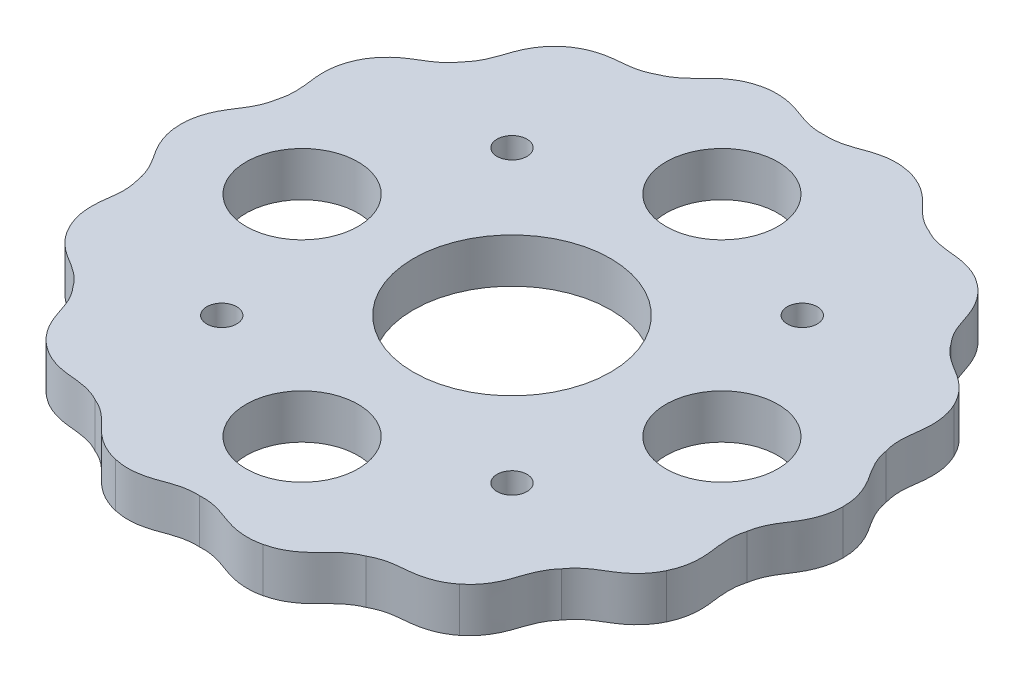
from build123d import *

# Parameters (mm, degrees)
BOSS_EXTRUDE3_DEPTH = 4.7625
SKETCH2_R           = 10.5635
SKETCH2_R_2         = 6
CUT_EXTRUDE1_DEPTH  = 4.7625
SKETCH2_4_R         = 1.607
CUT_EXTRUDE2_DEPTH  = 2.4105


with BuildPart() as part:
    # Sketch1 → Boss-Extrude3 (new body)
    with BuildSketch(Plane(origin=(0, 0, 0), x_dir=(1, 0, 0), z_dir=(0, 1, 0))):
        with BuildLine():
            Line((35.500002326, 0.003735881), (35.500002326, 0))
            Line((35.500002326, 0), (35.500002326, -0.003735881))
            add(Edge.make_bspline(
                [(32.644810899, -7.45096506), (32.674793712, -7.260710929), (32.757965618, -6.873262555), (32.975088878, -6.197475635), (33.30681421, -5.487322542), (33.693887271, -4.83935734), (34.139372051, -4.165162167), (34.499748971, -3.6014921), (34.870711868, -2.889611748), (35.149566879, -2.192738575), (35.418263863, -1.23361479), (35.50061524, -0.495919336), (35.500002326, -0.003735881)],
                knots=[0.02301065, 0.02301065, 0.02301065, 0.02301065, 0.053541567, 0.084072485, 0.145134319, 0.206196153, 0.267257988, 0.389381656, 0.511505325, 0.633628994, 0.755752663, 1, 1, 1, 1], degree=3))
            add(Edge.make_bspline(
                [(31.986017844, -15.399507835), (32.200120458, -14.956331799), (32.445998494, -14.255960238), (32.62005909, -13.275236314), (32.671181344, -12.526384626), (32.645828632, -11.724047822), (32.565707523, -11.059836954), (32.456861927, -10.25911949), (32.389262714, -9.507378309), (32.398512397, -8.723622254), (32.496104055, -8.020553026), (32.589276306, -7.635387164), (32.644810899, -7.45096506)],
                knots=[0.02301065, 0.02301065, 0.02301065, 0.02301065, 0.267257988, 0.389381656, 0.511505325, 0.633628994, 0.755752663, 0.816814497, 0.877876331, 0.938938166, 0.969469083, 1, 1, 1, 1], degree=3))
            Line((31.986017844, -15.399507835), (31.984396906, -15.402873748))
            Line((31.984396906, -15.402873748), (31.982775968, -15.406239661))
            add(Edge.make_bspline(
                [(26.179105738, -20.877140171), (26.288667493, -20.718736177), (26.531710341, -20.405744191), (27.020544594, -19.891087467), (27.62754267, -19.395191866), (28.257425012, -18.979340099), (28.951315253, -18.565199839), (29.520570914, -18.213712342), (30.163670245, -17.733285076), (30.717271866, -17.226414698), (31.375507699, -16.478857279), (31.769777787, -15.849947564), (31.982775968, -15.406239661)],
                knots=[0.02301065, 0.02301065, 0.02301065, 0.02301065, 0.053541567, 0.084072485, 0.145134319, 0.206196153, 0.267257988, 0.389381656, 0.511505325, 0.633628994, 0.755752663, 1, 1, 1, 1], degree=3))
            add(Edge.make_bspline(
                [(22.136810246, -27.752690162), (22.521996911, -27.446297993), (23.047405198, -26.921967502), (23.62974854, -26.113887841), (24.00072267, -25.461376898), (24.326001557, -24.727496287), (24.542005228, -24.094299727), (24.791357022, -23.325651886), (25.05662051, -22.619026286), (25.405013194, -21.916899767), (25.797990545, -21.325799714), (26.049053047, -21.019203188), (26.179105738, -20.877140171)],
                knots=[0.02301065, 0.02301065, 0.02301065, 0.02301065, 0.267257988, 0.389381656, 0.511505325, 0.633628994, 0.755752663, 0.816814497, 0.877876331, 0.938938166, 0.969469083, 1, 1, 1, 1], degree=3))
            Line((22.136810246, -27.752690162), (22.133889416, -27.755019446))
            Line((22.133889416, -27.755019446), (22.130968587, -27.75734873))
            add(Edge.make_bspline(
                [(14.52830762, -30.168341629), (14.695748267, -30.073161626), (15.05052444, -29.89661793), (15.714250068, -29.645025478), (16.476297475, -29.461605575), (17.224233175, -29.360231784), (18.029095404, -29.288171996), (18.694481743, -29.218483478), (19.482343797, -29.064663811), (20.201044438, -28.848188121), (21.118447439, -28.460259983), (21.746546212, -28.06469929), (22.130968587, -27.75734873)],
                knots=[0.02301065, 0.02301065, 0.02301065, 0.02301065, 0.053541567, 0.084072485, 0.145134319, 0.206196153, 0.267257988, 0.389381656, 0.511505325, 0.633628994, 0.755752663, 1, 1, 1, 1], degree=3))
            add(Edge.make_bspline(
                [(7.903135888, -34.609111839), (8.383115662, -34.500188263), (9.083990645, -34.255748926), (9.959276491, -33.780363616), (10.576626521, -33.353431213), (11.188111536, -32.833360849), (11.657457809, -32.356590942), (12.215619812, -31.772252855), (12.761207314, -31.250698702), (13.379739556, -30.769266488), (13.990268616, -30.407210225), (14.349495361, -30.239908237), (14.52830762, -30.168341629)],
                knots=[0.02301065, 0.02301065, 0.02301065, 0.02301065, 0.267257988, 0.389381656, 0.511505325, 0.633628994, 0.755752663, 0.816814497, 0.877876331, 0.938938166, 0.969469083, 1, 1, 1, 1], degree=3))
            Line((7.903135888, -34.609111839), (7.899493673, -34.60994315))
            Line((7.899493673, -34.60994315), (7.895851458, -34.610774462))
            add(Edge.make_bspline(
                [(0, -33.484333037), (0.192155866, -33.471228592), (0.588397592, -33.466099831), (1.295555593, -33.527402621), (2.061719496, -33.692786976), (2.779570716, -33.925969485), (3.535992098, -34.210262493), (4.165721189, -34.43617562), (4.942300224, -34.639429423), (5.683752409, -34.756224087), (6.678619663, -34.804759157), (7.416144457, -34.72089313), (7.895851458, -34.610774462)],
                knots=[0.02301065, 0.02301065, 0.02301065, 0.02301065, 0.053541567, 0.084072485, 0.145134319, 0.206196153, 0.267257988, 0.389381656, 0.511505325, 0.633628994, 0.755752663, 1, 1, 1, 1], degree=3))
            add(Edge.make_bspline(
                [(-7.895851458, -34.610774462), (-7.416144457, -34.72089313), (-6.678619663, -34.804759157), (-5.683752409, -34.756224087), (-4.942300224, -34.639429423), (-4.165721189, -34.43617562), (-3.535992098, -34.210262493), (-2.779570716, -33.925969485), (-2.061719496, -33.692786976), (-1.295555593, -33.527402621), (-0.588397592, -33.466099831), (-0.192155866, -33.471228592), (0, -33.484333037)],
                knots=[0.02301065, 0.02301065, 0.02301065, 0.02301065, 0.267257988, 0.389381656, 0.511505325, 0.633628994, 0.755752663, 0.816814497, 0.877876331, 0.938938166, 0.969469083, 1, 1, 1, 1], degree=3))
            Line((-7.895851458, -34.610774462), (-7.899493673, -34.60994315))
            Line((-7.899493673, -34.60994315), (-7.903135888, -34.609111839))
            add(Edge.make_bspline(
                [(-14.52830762, -30.168341629), (-14.349495361, -30.239908237), (-13.990268616, -30.407210225), (-13.379739556, -30.769266488), (-12.761207314, -31.250698702), (-12.215619812, -31.772252855), (-11.657457809, -32.356590942), (-11.188111536, -32.833360849), (-10.576626521, -33.353431213), (-9.959276491, -33.780363616), (-9.083990645, -34.255748926), (-8.383115662, -34.500188263), (-7.903135888, -34.609111839)],
                knots=[0.02301065, 0.02301065, 0.02301065, 0.02301065, 0.053541567, 0.084072485, 0.145134319, 0.206196153, 0.267257988, 0.389381656, 0.511505325, 0.633628994, 0.755752663, 1, 1, 1, 1], degree=3))
            add(Edge.make_bspline(
                [(-22.130968587, -27.75734873), (-21.746546212, -28.06469929), (-21.118447439, -28.460259983), (-20.201044438, -28.848188121), (-19.482343797, -29.064663811), (-18.694481743, -29.218483478), (-18.029095404, -29.288171996), (-17.224233175, -29.360231784), (-16.476297475, -29.461605575), (-15.714250068, -29.645025478), (-15.05052444, -29.89661793), (-14.695748267, -30.073161626), (-14.52830762, -30.168341629)],
                knots=[0.02301065, 0.02301065, 0.02301065, 0.02301065, 0.267257988, 0.389381656, 0.511505325, 0.633628994, 0.755752663, 0.816814497, 0.877876331, 0.938938166, 0.969469083, 1, 1, 1, 1], degree=3))
            Line((-22.130968587, -27.75734873), (-22.133889416, -27.755019446))
            Line((-22.133889416, -27.755019446), (-22.136810246, -27.752690162))
            add(Edge.make_bspline(
                [(-26.179105738, -20.877140171), (-26.049053047, -21.019203188), (-25.797990545, -21.325799714), (-25.405013194, -21.916899767), (-25.05662051, -22.619026286), (-24.791357022, -23.325651886), (-24.542005228, -24.094299727), (-24.326001557, -24.727496287), (-24.00072267, -25.461376898), (-23.62974854, -26.113887841), (-23.047405198, -26.921967502), (-22.521996911, -27.446297993), (-22.136810246, -27.752690162)],
                knots=[0.02301065, 0.02301065, 0.02301065, 0.02301065, 0.053541567, 0.084072485, 0.145134319, 0.206196153, 0.267257988, 0.389381656, 0.511505325, 0.633628994, 0.755752663, 1, 1, 1, 1], degree=3))
            add(Edge.make_bspline(
                [(-31.982775968, -15.406239661), (-31.769777787, -15.849947564), (-31.375507698, -16.478857279), (-30.717271866, -17.226414698), (-30.163670245, -17.733285076), (-29.520570914, -18.213712342), (-28.951315253, -18.565199839), (-28.257425012, -18.979340099), (-27.62754267, -19.395191866), (-27.020544594, -19.891087467), (-26.531710341, -20.405744191), (-26.288667493, -20.718736177), (-26.179105738, -20.877140171)],
                knots=[0.02301065, 0.02301065, 0.02301065, 0.02301065, 0.267257988, 0.389381656, 0.511505325, 0.633628994, 0.755752663, 0.816814497, 0.877876331, 0.938938166, 0.969469083, 1, 1, 1, 1], degree=3))
            Line((-31.982775968, -15.406239661), (-31.984396906, -15.402873748))
            Line((-31.984396906, -15.402873748), (-31.986017844, -15.399507835))
            add(Edge.make_bspline(
                [(-32.644810899, -7.45096506), (-32.589276306, -7.635387164), (-32.496104055, -8.020553026), (-32.398512397, -8.723622254), (-32.389262714, -9.507378309), (-32.456861927, -10.25911949), (-32.565707523, -11.059836954), (-32.645828632, -11.724047822), (-32.671181344, -12.526384626), (-32.62005909, -13.275236314), (-32.445998494, -14.255960238), (-32.200120458, -14.956331799), (-31.986017844, -15.399507835)],
                knots=[0.02301065, 0.02301065, 0.02301065, 0.02301065, 0.053541567, 0.084072485, 0.145134319, 0.206196153, 0.267257988, 0.389381656, 0.511505325, 0.633628994, 0.755752663, 1, 1, 1, 1], degree=3))
            add(Edge.make_bspline(
                [(-35.500002326, -0.003735881), (-35.50061524, -0.495919336), (-35.418263863, -1.23361479), (-35.149566879, -2.192738575), (-34.870711868, -2.889611748), (-34.499748971, -3.6014921), (-34.139372051, -4.165162167), (-33.693887271, -4.83935734), (-33.30681421, -5.487322542), (-32.975088878, -6.197475635), (-32.757965618, -6.873262555), (-32.674793712, -7.260710929), (-32.644810899, -7.45096506)],
                knots=[0.02301065, 0.02301065, 0.02301065, 0.02301065, 0.267257988, 0.389381656, 0.511505325, 0.633628994, 0.755752663, 0.816814497, 0.877876331, 0.938938166, 0.969469083, 1, 1, 1, 1], degree=3))
            Line((-35.500002326, -0.003735881), (-35.500002326, 0))
            Line((-35.500002326, 0), (-35.500002326, 0.003735881))
            add(Edge.make_bspline(
                [(-32.644810899, 7.45096506), (-32.674793712, 7.260710929), (-32.757965618, 6.873262555), (-32.975088878, 6.197475635), (-33.30681421, 5.487322542), (-33.693887271, 4.83935734), (-34.139372051, 4.165162167), (-34.499748971, 3.6014921), (-34.870711868, 2.889611748), (-35.149566879, 2.192738575), (-35.418263863, 1.23361479), (-35.50061524, 0.495919336), (-35.500002326, 0.003735881)],
                knots=[0.02301065, 0.02301065, 0.02301065, 0.02301065, 0.053541567, 0.084072485, 0.145134319, 0.206196153, 0.267257988, 0.389381656, 0.511505325, 0.633628994, 0.755752663, 1, 1, 1, 1], degree=3))
            add(Edge.make_bspline(
                [(-31.986017844, 15.399507835), (-32.200120458, 14.956331799), (-32.445998494, 14.255960238), (-32.62005909, 13.275236314), (-32.671181344, 12.526384626), (-32.645828632, 11.724047822), (-32.565707523, 11.059836954), (-32.456861927, 10.25911949), (-32.389262714, 9.507378309), (-32.398512397, 8.723622254), (-32.496104055, 8.020553026), (-32.589276306, 7.635387164), (-32.644810899, 7.45096506)],
                knots=[0.02301065, 0.02301065, 0.02301065, 0.02301065, 0.267257988, 0.389381656, 0.511505325, 0.633628994, 0.755752663, 0.816814497, 0.877876331, 0.938938166, 0.969469083, 1, 1, 1, 1], degree=3))
            Line((-31.986017844, 15.399507835), (-31.984396906, 15.402873748))
            Line((-31.984396906, 15.402873748), (-31.982775968, 15.406239661))
            add(Edge.make_bspline(
                [(-26.179105738, 20.877140171), (-26.288667493, 20.718736177), (-26.531710341, 20.405744191), (-27.020544594, 19.891087467), (-27.62754267, 19.395191866), (-28.257425012, 18.979340099), (-28.951315253, 18.565199839), (-29.520570914, 18.213712342), (-30.163670245, 17.733285076), (-30.717271866, 17.226414698), (-31.375507699, 16.478857278), (-31.769777787, 15.849947564), (-31.982775968, 15.406239661)],
                knots=[0.02301065, 0.02301065, 0.02301065, 0.02301065, 0.053541567, 0.084072485, 0.145134319, 0.206196153, 0.267257988, 0.389381656, 0.511505325, 0.633628994, 0.755752663, 1, 1, 1, 1], degree=3))
            add(Edge.make_bspline(
                [(-22.136810246, 27.752690162), (-22.521996911, 27.446297993), (-23.047405198, 26.921967502), (-23.62974854, 26.113887841), (-24.00072267, 25.461376898), (-24.326001557, 24.727496287), (-24.542005228, 24.094299727), (-24.791357022, 23.325651886), (-25.05662051, 22.619026286), (-25.405013194, 21.916899767), (-25.797990545, 21.325799714), (-26.049053047, 21.019203188), (-26.179105738, 20.877140171)],
                knots=[0.02301065, 0.02301065, 0.02301065, 0.02301065, 0.267257988, 0.389381656, 0.511505325, 0.633628994, 0.755752663, 0.816814497, 0.877876331, 0.938938166, 0.969469083, 1, 1, 1, 1], degree=3))
            Line((-22.136810246, 27.752690162), (-22.133889416, 27.755019446))
            Line((-22.133889416, 27.755019446), (-22.130968587, 27.75734873))
            add(Edge.make_bspline(
                [(-14.52830762, 30.168341629), (-14.695748267, 30.073161626), (-15.05052444, 29.89661793), (-15.714250068, 29.645025478), (-16.476297475, 29.461605575), (-17.224233175, 29.360231784), (-18.029095404, 29.288171996), (-18.694481743, 29.218483478), (-19.482343797, 29.064663811), (-20.201044438, 28.848188121), (-21.118447439, 28.460259983), (-21.746546212, 28.06469929), (-22.130968587, 27.75734873)],
                knots=[0.02301065, 0.02301065, 0.02301065, 0.02301065, 0.053541567, 0.084072485, 0.145134319, 0.206196153, 0.267257988, 0.389381656, 0.511505325, 0.633628994, 0.755752663, 1, 1, 1, 1], degree=3))
            add(Edge.make_bspline(
                [(-7.903135888, 34.609111839), (-8.383115662, 34.500188263), (-9.083990645, 34.255748926), (-9.959276491, 33.780363616), (-10.576626521, 33.353431213), (-11.188111536, 32.833360849), (-11.657457809, 32.356590942), (-12.215619812, 31.772252855), (-12.761207314, 31.250698702), (-13.379739556, 30.769266488), (-13.990268616, 30.407210225), (-14.349495361, 30.239908237), (-14.52830762, 30.168341629)],
                knots=[0.02301065, 0.02301065, 0.02301065, 0.02301065, 0.267257988, 0.389381656, 0.511505325, 0.633628994, 0.755752663, 0.816814497, 0.877876331, 0.938938166, 0.969469083, 1, 1, 1, 1], degree=3))
            Line((-7.903135888, 34.609111839), (-7.899493673, 34.60994315))
            Line((-7.899493673, 34.60994315), (-7.895851458, 34.610774462))
            add(Edge.make_bspline(
                [(0, 33.484333037), (-0.192155866, 33.471228592), (-0.588397592, 33.466099831), (-1.295555593, 33.527402621), (-2.061719496, 33.692786976), (-2.779570716, 33.925969485), (-3.535992098, 34.210262493), (-4.165721189, 34.43617562), (-4.942300224, 34.639429423), (-5.683752409, 34.756224087), (-6.678619663, 34.804759157), (-7.416144457, 34.72089313), (-7.895851458, 34.610774462)],
                knots=[0.02301065, 0.02301065, 0.02301065, 0.02301065, 0.053541567, 0.084072485, 0.145134319, 0.206196153, 0.267257988, 0.389381656, 0.511505325, 0.633628994, 0.755752663, 1, 1, 1, 1], degree=3))
            add(Edge.make_bspline(
                [(7.895851458, 34.610774462), (7.416144457, 34.72089313), (6.678619663, 34.804759157), (5.683752409, 34.756224087), (4.942300224, 34.639429423), (4.165721189, 34.43617562), (3.535992098, 34.210262493), (2.779570716, 33.925969485), (2.061719496, 33.692786976), (1.295555593, 33.527402621), (0.588397592, 33.466099831), (0.192155866, 33.471228592), (0, 33.484333037)],
                knots=[0.02301065, 0.02301065, 0.02301065, 0.02301065, 0.267257988, 0.389381656, 0.511505325, 0.633628994, 0.755752663, 0.816814497, 0.877876331, 0.938938166, 0.969469083, 1, 1, 1, 1], degree=3))
            Line((7.895851458, 34.610774462), (7.899493673, 34.60994315))
            Line((7.899493673, 34.60994315), (7.903135888, 34.609111839))
            add(Edge.make_bspline(
                [(14.52830762, 30.168341629), (14.349495361, 30.239908237), (13.990268616, 30.407210225), (13.379739556, 30.769266488), (12.761207314, 31.250698702), (12.215619812, 31.772252855), (11.657457809, 32.356590942), (11.188111536, 32.833360849), (10.576626521, 33.353431213), (9.959276491, 33.780363616), (9.083990645, 34.255748926), (8.383115662, 34.500188263), (7.903135888, 34.609111839)],
                knots=[0.02301065, 0.02301065, 0.02301065, 0.02301065, 0.053541567, 0.084072485, 0.145134319, 0.206196153, 0.267257988, 0.389381656, 0.511505325, 0.633628994, 0.755752663, 1, 1, 1, 1], degree=3))
            add(Edge.make_bspline(
                [(22.130968587, 27.75734873), (21.746546212, 28.06469929), (21.118447439, 28.460259983), (20.201044438, 28.848188121), (19.482343797, 29.064663811), (18.694481743, 29.218483478), (18.029095404, 29.288171996), (17.224233175, 29.360231784), (16.476297475, 29.461605575), (15.714250068, 29.645025478), (15.05052444, 29.89661793), (14.695748267, 30.073161626), (14.52830762, 30.168341629)],
                knots=[0.02301065, 0.02301065, 0.02301065, 0.02301065, 0.267257988, 0.389381656, 0.511505325, 0.633628994, 0.755752663, 0.816814497, 0.877876331, 0.938938166, 0.969469083, 1, 1, 1, 1], degree=3))
            Line((22.130968587, 27.75734873), (22.133889416, 27.755019446))
            Line((22.133889416, 27.755019446), (22.136810246, 27.752690162))
            add(Edge.make_bspline(
                [(26.179105738, 20.877140171), (26.049053047, 21.019203188), (25.797990545, 21.325799714), (25.405013194, 21.916899767), (25.05662051, 22.619026286), (24.791357022, 23.325651886), (24.542005228, 24.094299727), (24.326001557, 24.727496287), (24.00072267, 25.461376898), (23.62974854, 26.113887841), (23.047405198, 26.921967502), (22.521996911, 27.446297993), (22.136810246, 27.752690162)],
                knots=[0.02301065, 0.02301065, 0.02301065, 0.02301065, 0.053541567, 0.084072485, 0.145134319, 0.206196153, 0.267257988, 0.389381656, 0.511505325, 0.633628994, 0.755752663, 1, 1, 1, 1], degree=3))
            add(Edge.make_bspline(
                [(31.982775968, 15.406239661), (31.769777787, 15.849947564), (31.375507698, 16.478857279), (30.717271866, 17.226414698), (30.163670245, 17.733285076), (29.520570914, 18.213712342), (28.951315253, 18.565199839), (28.257425012, 18.979340099), (27.62754267, 19.395191866), (27.020544594, 19.891087467), (26.531710341, 20.405744191), (26.288667493, 20.718736177), (26.179105738, 20.877140171)],
                knots=[0.02301065, 0.02301065, 0.02301065, 0.02301065, 0.267257988, 0.389381656, 0.511505325, 0.633628994, 0.755752663, 0.816814497, 0.877876331, 0.938938166, 0.969469083, 1, 1, 1, 1], degree=3))
            Line((31.982775968, 15.406239661), (31.984396906, 15.402873748))
            Line((31.984396906, 15.402873748), (31.986017844, 15.399507835))
            add(Edge.make_bspline(
                [(32.644810899, 7.45096506), (32.589276306, 7.635387164), (32.496104055, 8.020553026), (32.398512397, 8.723622254), (32.389262714, 9.507378309), (32.456861927, 10.25911949), (32.565707523, 11.059836954), (32.645828632, 11.724047822), (32.671181344, 12.526384626), (32.62005909, 13.275236314), (32.445998494, 14.255960238), (32.200120458, 14.956331799), (31.986017844, 15.399507835)],
                knots=[0.02301065, 0.02301065, 0.02301065, 0.02301065, 0.053541567, 0.084072485, 0.145134319, 0.206196153, 0.267257988, 0.389381656, 0.511505325, 0.633628994, 0.755752663, 1, 1, 1, 1], degree=3))
            add(Edge.make_bspline(
                [(35.500002326, 0.003735881), (35.50061524, 0.495919336), (35.418263863, 1.23361479), (35.149566879, 2.192738575), (34.870711868, 2.889611748), (34.499748971, 3.6014921), (34.139372051, 4.165162167), (33.693887271, 4.83935734), (33.30681421, 5.487322542), (32.975088878, 6.197475635), (32.757965618, 6.873262555), (32.674793712, 7.260710929), (32.644810899, 7.45096506)],
                knots=[0.02301065, 0.02301065, 0.02301065, 0.02301065, 0.267257988, 0.389381656, 0.511505325, 0.633628994, 0.755752663, 0.816814497, 0.877876331, 0.938938166, 0.969469083, 1, 1, 1, 1], degree=3))
        make_face()
    extrude(amount=BOSS_EXTRUDE3_DEPTH)

    # Sketch2 → Cut-Extrude1 (cut)
    with BuildSketch(Plane(origin=(0, 4.7625, 0), x_dir=(1, 0, 0), z_dir=(0, 1, 0))):
        Circle(SKETCH2_R)
        with Locations((22.5, 0)):
            Circle(SKETCH2_R_2)
        with Locations((0, -22.5)):
            Circle(SKETCH2_R_2)
        with Locations((-22.5, 0)):
            Circle(SKETCH2_R_2)
        with Locations((0, 22.5)):
            Circle(SKETCH2_R_2)
    extrude(amount=-CUT_EXTRUDE1_DEPTH, mode=Mode.SUBTRACT)

    # Sketch2<4> → Cut-Extrude2 (cut)
    with BuildSketch(Plane(origin=(0, 4.7625, 0), x_dir=(1, 0, 0), z_dir=(0, 1, 0))):
        with Locations((15.556349186, 15.556349186)):
            Circle(SKETCH2_4_R)
        with Locations((15.556349186, -15.556349186)):
            Circle(SKETCH2_4_R)
        with Locations((-15.556349186, -15.556349186)):
            Circle(SKETCH2_4_R)
        with Locations((-15.556349186, 15.556349186)):
            Circle(SKETCH2_4_R)
    extrude(amount=-CUT_EXTRUDE2_DEPTH, mode=Mode.SUBTRACT)


solid = part.part
